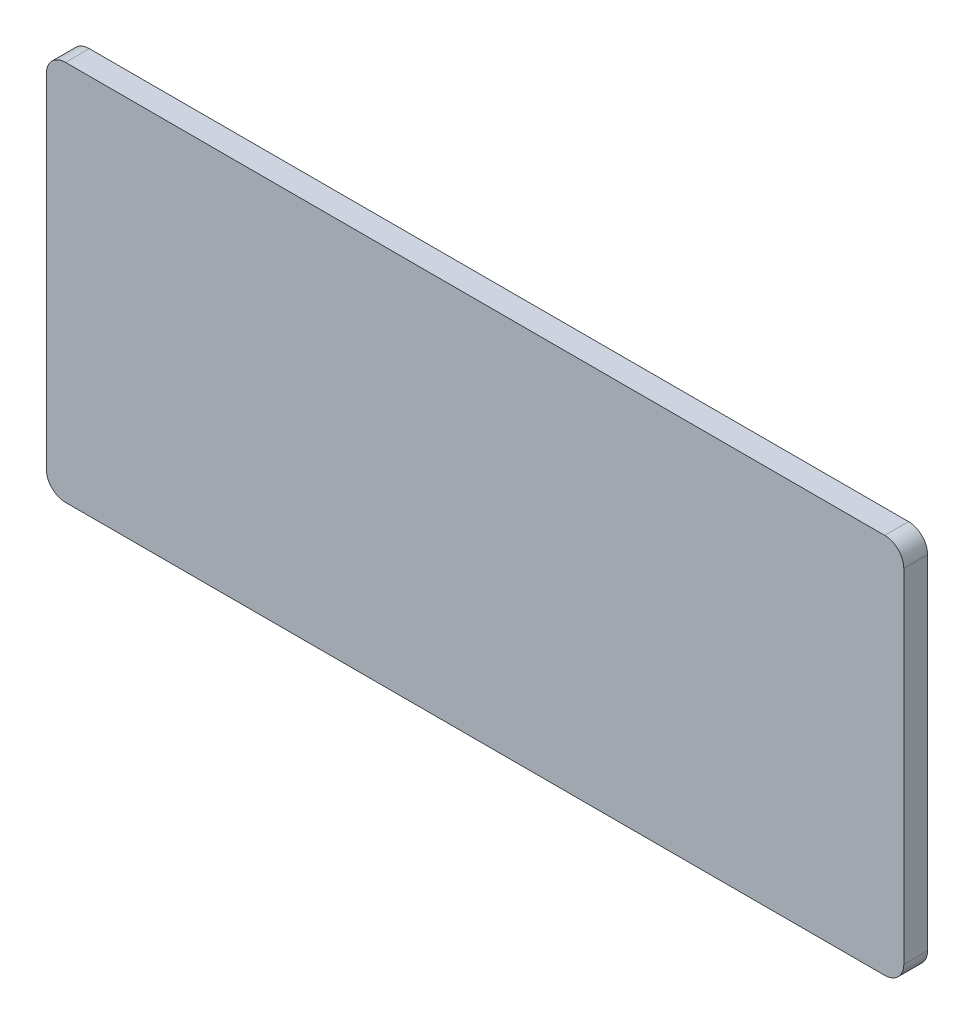
from build123d import *

# Parameters (mm, degrees)
SKETCH1_W           = 114.3
SKETCH1_H           = 50.8
BOSS_EXTRUDE1_DEPTH = 3.175
FILLET1_R           = 2.54


with BuildPart() as part:
    # Sketch1 → Boss-Extrude1 (new body)
    with BuildSketch(Plane.XY):
        Rectangle(SKETCH1_W, SKETCH1_H)
    extrude(amount=BOSS_EXTRUDE1_DEPTH)

    # Fillet1
    fillet1_edges = [part.edges().sort_by_distance(p)[0] for p in [
        (-57.15, -25.4, 1.5875),
        (-57.15, 25.4, 1.5875),
        (57.15, -25.4, 1.5875),
        (57.15, 25.4, 1.5875),
    ]]
    fillet(fillet1_edges, radius=FILLET1_R)


solid = part.part
